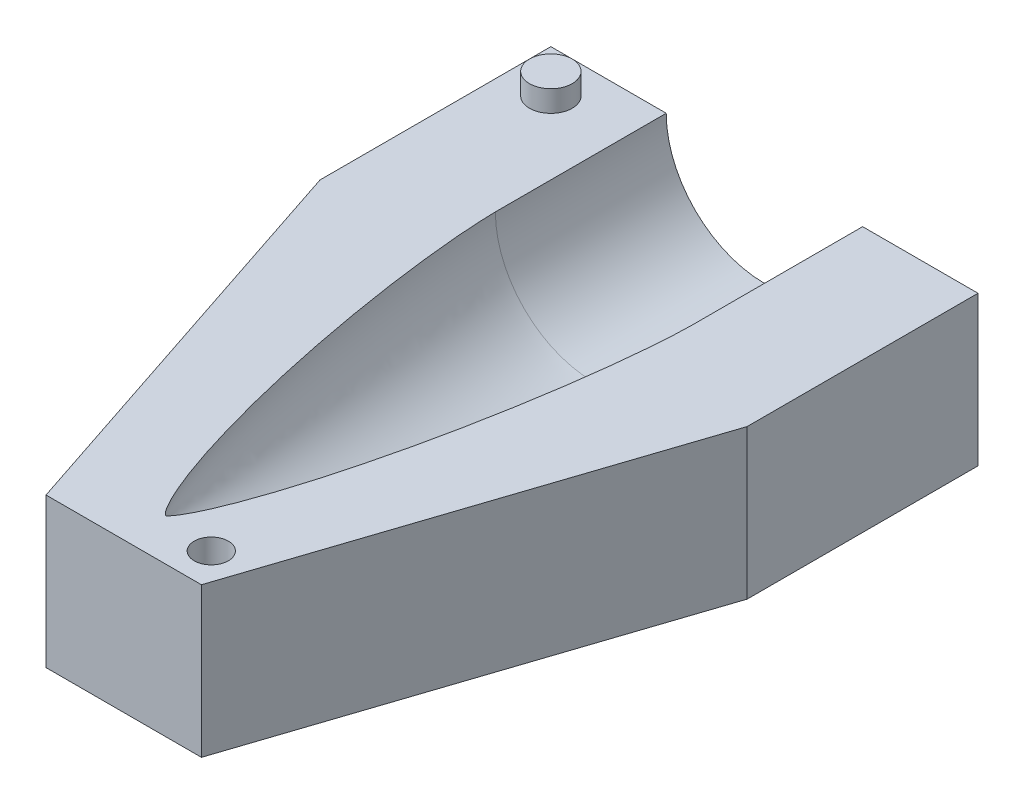
from build123d import *

# Parameters (mm, degrees)
SKETCH2_W            = 150
SKETCH2_H            = 70
BOSS_EXTRUDE1_DEPTH  = 50
INTERSECT1_OUTLINE_W = 100
INTERSECT1_OUTLINE_H = 150
INTERSECT1_DEPTH     = 35
CUT_EXTRUDE1_DEPTH   = 153.887652053
SKETCH4_R            = 4
CUT_EXTRUDE3_DEPTH   = 6
SKETCH8_R            = 5
BOSS_EXTRUDE3_DEPTH  = 5


# Read off the part's stored shape, not the designer's step: Intersect1
with BuildPart() as part:
    # Sketch2 → Boss-Extrude1 (new, symmetric)
    with BuildSketch(Plane(origin=(0, 0, 0), x_dir=(0, 0, -1), z_dir=(1, 0, 0))):
        with Locations((65.177152604, 0)):
            Rectangle(SKETCH2_W, SKETCH2_H)
    extrude(amount=BOSS_EXTRUDE1_DEPTH, both=True)

    # Sketch1 → Cut-Revolve1 (revolve, cut)
    with BuildSketch(Plane(origin=(0, 0, 0), x_dir=(0, 0, -1), z_dir=(1, 0, 0)), mode=Mode.PRIVATE) as cut_revolve1_sk:
        with BuildLine():
            Line((140.177152604, 22.991315667), (100.177152604, 22.991315667))
            add(Edge.make_bspline(
                [(0, 0), (0.003001049, 0.012379499), (0.011197692, 0.036351162), (0.030910939, 0.072587893), (0.061826137, 0.121023529), (0.108056169, 0.183557631), (0.181890949, 0.271568579), (0.306591117, 0.401983994), (0.524430354, 0.601235581), (0.901337009, 0.902060291), (1.552737658, 1.35492318), (2.678502901, 2.03469009), (4.445764918, 2.96045388), (7.403328149, 4.31706154), (11.599431889, 5.985386832), (16.823063538, 7.814259146), (22.879973582, 9.705127394), (29.12300565, 11.472646372), (35.403551613, 13.101460315), (41.714266155, 14.60858848), (48.050573205, 16.004129586), (54.409190393, 17.293961353), (60.787889899, 18.480587367), (67.185029056, 19.563313869), (73.599488728, 20.538609835), (80.030497438, 21.398160754), (86.47762614, 22.128684831), (91.82278076, 22.603702016), (96.058091382, 22.875635683), (98.677996749, 22.971409991), (99.677383084, 22.991315667), (100.177152604, 22.991315667)],
                knots=[0, 0, 0, 0, 0, 0.000489987, 0.000979974, 0.001581787, 0.002219798, 0.003488078, 0.005411983, 0.008540376, 0.013605957, 0.022087023, 0.03601085, 0.059264391, 0.090564505, 0.147620712, 0.210220905, 0.272821133, 0.335421343, 0.398021557, 0.460621765, 0.523221981, 0.585822195, 0.648422407, 0.711022626, 0.773622837, 0.836223055, 0.89882327, 0.961423485, 0.980711742, 1, 1, 1, 1, 1], degree=4))
            Line((0, 0), (140.177152604, 0))
            Line((140.177152604, 0), (140.177152604, 22.991315667))
        make_face()
    revolve(cut_revolve1_sk.sketch.rotate(Axis((0, 0, 0), (0, 0, -1)), 90), axis=Axis((0, 0, 0), (0, 0, -1)), mode=Mode.SUBTRACT)

    # Intersect1 outline → Intersect1 (cut)
    with BuildSketch(Plane(origin=(0, 0, 0), x_dir=(1, 0, 0), z_dir=(0, 1, 0))):
        with Locations((0, 65.177152604)):
            Rectangle(INTERSECT1_OUTLINE_W, INTERSECT1_OUTLINE_H)
    extrude(amount=INTERSECT1_DEPTH, mode=Mode.SUBTRACT)

    # Sketch5 → Cut-Extrude1 (cut, through all)
    with BuildSketch(Plane(origin=(0, 0, 0), x_dir=(1, 0, 0), z_dir=(0, 1, 0))):
        Polygon((50, 86.137976919), (18.194421541, -9.822847396), (0, -21.198201401), (-18.194421541, -9.822847396), (-50, 86.137976919), (-75.365394844, 84.804131947), (-88.729692443, -46.913449713), (-13.099565549, -40.658440604), (76.90354762, -33.214709966), (74.65964276, 87.590776178), align=None)
    extrude(amount=-CUT_EXTRUDE1_DEPTH, mode=Mode.SUBTRACT)

    # Sketch4 → Cut-Extrude3 (cut)
    with BuildSketch(Plane(origin=(0, 0, 0), x_dir=(1, 0, 0), z_dir=(0, 1, 0))):
        with Locations(Location((12.5, -1.822847396, 0), (0, 0, 270))):
            Circle(SKETCH4_R)
    extrude(amount=-CUT_EXTRUDE3_DEPTH, mode=Mode.SUBTRACT)

    # Sketch8 → Boss-Extrude3 (add)
    with BuildSketch(Plane(origin=(0, 0, 0), x_dir=(1, 0, 0), z_dir=(0, 1, 0))):
        with Locations(Location((-40, 130.177152604, 0), (0, 0, 270))):
            Circle(SKETCH8_R)
    extrude(amount=BOSS_EXTRUDE3_DEPTH)


solid = part.part
